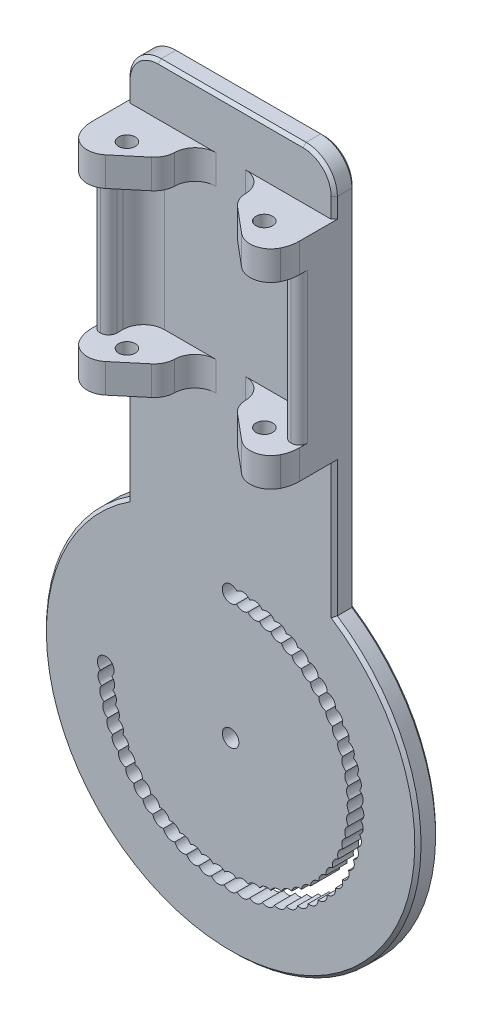
from build123d import *

# Parameters (mm, degrees)
BOSS_EXTRUDE2_DEPTH     = 7
CUT_EXTRUDE2_DEPTH      = 30.130224853
CUT_EXTRUDE2_DEPTH_BACK = 30.130224853
SKETCH3_R               = 2
BOSS_EXTRUDE3_DEPTH     = 36
SKETCH5_R               = 2
BOSS_EXTRUDE4_DEPTH     = 7
SKETCH13_W              = 49.8
SKETCH13_H              = 5
BOSS_EXTRUDE6_DEPTH     = 12.25
SKETCH14_R              = 2
BOSS_EXTRUDE7_DEPTH     = 5
FILLET1_DEPTH           = 7
FILLET1_START           = 43
FILLET1_2_DEPTH         = 7
FILLET3_R               = 2
FILLET4_R               = 5
FILLET5_R               = 5
FILLET6_R               = 7.5
CHAMFER1_SIZE           = 0.75


with BuildPart() as part:
    # Sketch1 → Boss-Extrude2 (new body)
    with BuildSketch(Plane(origin=(0, 0, 0), x_dir=(1, 0, 0), z_dir=(0, 1, 0))):
        with BuildLine():
            Line((-24.9, 0), (-24.9, 13.4))
            Line((-24.9, 13.4), (24.9, 13.4))
            Line((24.9, 13.4), (24.9, 0))
            ThreePointArc((24.9, 0), (23.392904185, -4.800819919), (19.412411454, -7.878950407))
            Line((19.412411454, -7.878950407), (8.235013612, 1.5))
            ThreePointArc((8.235013612, 1.5), (11.116692467, 6.448255578), (16.5, 8.4))
            Line((16.5, 8.4), (-16.5, 8.4))
            ThreePointArc((-16.5, 8.4), (-11.116692467, 6.448255578), (-8.235013612, 1.5))
            Line((-8.235013612, 1.5), (-19.412411454, -7.878950407))
            ThreePointArc((-19.412411454, -7.878950407), (-23.392904185, -4.800819919), (-24.9, 0))
        make_face()
    extrude(amount=BOSS_EXTRUDE2_DEPTH)

    # Sketch3 → Cut-Extrude2 (cut, two sides: drawn at the far end of the back side and taken through both)
    with BuildSketch(Plane(origin=(0, 7, 0), x_dir=(1, 0, 0), z_dir=(0, 1, 0)).offset(-CUT_EXTRUDE2_DEPTH_BACK)):
        with Locations(Location((-16.5, 0, 0), (0, 0, 270))):
            Circle(SKETCH3_R)
        with Locations(Location((16.5, 0, 0), (0, 0, 270))):
            Circle(SKETCH3_R)
    extrude(amount=CUT_EXTRUDE2_DEPTH + CUT_EXTRUDE2_DEPTH_BACK, mode=Mode.SUBTRACT)

    # Sketch4 → Boss-Extrude3 (add)
    with BuildSketch(Plane(origin=(0, 7, 0), x_dir=(1, 0, 0), z_dir=(0, 1, 0))):
        Polygon((-24.9, 13.4), (-24.9, 0), (-20.9, 0), (-20.9, 8.4), (-16.5, 8.4), (16.5, 8.4), (20.9, 8.4), (20.9, 0), (24.9, 0), (24.9, 13.4), align=None)
    extrude(amount=BOSS_EXTRUDE3_DEPTH)

    # Sketch5 → Boss-Extrude4 (add)
    with BuildSketch(Plane(origin=(0, 43, 0), x_dir=(1, 0, 0), z_dir=(0, 1, 0))):
        with BuildLine():
            Line((-24.9, 13.4), (-24.9, 0))
            ThreePointArc((-24.9, 0), (-23.392904185, -4.800819919), (-19.412411454, -7.878950407))
            Line((-19.412411454, -7.878950407), (-8.235013612, 1.5))
            ThreePointArc((-8.235013612, 1.5), (-11.116692467, 6.448255578), (-16.5, 8.4))
            Line((-16.5, 8.4), (16.5, 8.4))
            ThreePointArc((16.5, 8.4), (11.116692467, 6.448255578), (8.235013612, 1.5))
            Line((8.235013612, 1.5), (19.412411454, -7.878950407))
            ThreePointArc((19.412411454, -7.878950407), (23.392904185, -4.800819919), (24.9, 0))
            Line((24.9, 0), (24.9, 13.4))
            Line((24.9, 13.4), (-24.9, 13.4))
        make_face()
        with Locations(Location((16.5, 0, 0), (0, 0, 270))):
            Circle(SKETCH5_R, mode=Mode.SUBTRACT)
        with Locations(Location((-16.5, 0, 0), (0, 0, 270))):
            Circle(SKETCH5_R, mode=Mode.SUBTRACT)
    extrude(amount=BOSS_EXTRUDE4_DEPTH)

    # Sketch13 → Boss-Extrude6 (add)
    with BuildSketch(Plane(origin=(0, 50, 0), x_dir=(1, 0, 0), z_dir=(0, 1, 0))):
        with Locations((0, 10.9)):
            Rectangle(SKETCH13_W, SKETCH13_H)
    extrude(amount=BOSS_EXTRUDE6_DEPTH)

    # Sketch14 → Boss-Extrude7 (add)
    with BuildSketch(Plane(origin=(0, 0, -13.4), x_dir=(-1, 0, 0), z_dir=(0, 0, -1))):
        with BuildLine():
            Line((-24.9, 0), (24.9, 0))
            Line((24.9, 0), (24.9, -32.516803765))
            ThreePointArc((24.9, -32.516803765), (0, -115), (-24.9, -32.516803765))
            Line((-24.9, -32.516803765), (-24.9, 0))
        make_face()
        with Locations((0, -70)):
            Circle(SKETCH14_R, mode=Mode.SUBTRACT)
        with BuildLine():
            ThreePointArc((-1.403822899, -41.424528438), (1.997590912, -39.901864651), (-1.536691311, -38.719929762))
            ThreePointArc((-1.536691311, -38.719929762), (-3.136548491, -38.154088746), (-4.595274757, -39.021173938))
            ThreePointArc((-4.595274757, -39.021173938), (-6.242890305, -38.614871027), (-7.609603194, -39.620761144))
            ThreePointArc((-7.609603194, -39.620761144), (-9.289109672, -39.377909257), (-10.550646993, -40.512917026))
            ThreePointArc((-10.550646993, -40.512917026), (-12.245869836, -40.43585496), (-13.390082294, -41.689049637))
            ThreePointArc((-13.390082294, -41.689049637), (-15.084695578, -41.778519541), (-16.100563782, -43.137832177))
            ThreePointArc((-16.100563782, -43.137832177), (-17.778247457, -43.392972406), (-18.65598804, -44.845312077))
            ThreePointArc((-18.65598804, -44.845312077), (-20.300585093, -45.263665492), (-21.031744934, -46.795045372))
            ThreePointArc((-21.031744934, -46.795045372), (-22.627416998, -47.372583002), (-23.204954628, -48.968255066))
            ThreePointArc((-23.204954628, -48.968255066), (-24.736334508, -49.699414907), (-25.154687923, -51.34401196))
            ThreePointArc((-25.154687923, -51.34401196), (-26.607027594, -52.221752543), (-26.862167823, -53.899436218))
            ThreePointArc((-26.862167823, -53.899436218), (-28.221480459, -54.915304422), (-28.310950363, -56.609917706))
            ThreePointArc((-28.310950363, -56.609917706), (-29.56414504, -57.754130164), (-29.487082974, -59.449353007))
            ThreePointArc((-29.487082974, -59.449353007), (-30.622090743, -60.710890328), (-30.379238856, -62.390396806))
            ThreePointArc((-30.379238856, -62.390396806), (-31.385128973, -63.757109695), (-30.978826062, -65.404725243))
            ThreePointArc((-30.978826062, -65.404725243), (-31.845911254, -66.863451509), (-31.280070238, -68.463308689))
            ThreePointArc((-31.280070238, -68.463308689), (-32, -70), (-31.280070238, -71.536691311))
            ThreePointArc((-31.280070238, -71.536691311), (-31.845911254, -73.136548491), (-30.978826062, -74.595274757))
            ThreePointArc((-30.978826062, -74.595274757), (-31.385128973, -76.242890305), (-30.379238856, -77.609603194))
            ThreePointArc((-30.379238856, -77.609603194), (-30.622090743, -79.289109672), (-29.487082974, -80.550646993))
            ThreePointArc((-29.487082974, -80.550646993), (-29.56414504, -82.245869836), (-28.310950363, -83.390082294))
            ThreePointArc((-28.310950363, -83.390082294), (-28.221480459, -85.084695578), (-26.862167823, -86.100563782))
            ThreePointArc((-26.862167823, -86.100563782), (-26.607027594, -87.778247457), (-25.154687923, -88.65598804))
            ThreePointArc((-25.154687923, -88.65598804), (-24.736334508, -90.300585093), (-23.204954628, -91.031744934))
            ThreePointArc((-23.204954628, -91.031744934), (-22.627416998, -92.627416998), (-21.031744934, -93.204954628))
            ThreePointArc((-21.031744934, -93.204954628), (-20.300585093, -94.736334508), (-18.65598804, -95.154687923))
            ThreePointArc((-18.65598804, -95.154687923), (-17.778247457, -96.607027594), (-16.100563782, -96.862167823))
            ThreePointArc((-16.100563782, -96.862167823), (-15.084695578, -98.221480459), (-13.390082294, -98.310950363))
            ThreePointArc((-13.390082294, -98.310950363), (-12.245869836, -99.56414504), (-10.550646993, -99.487082974))
            ThreePointArc((-10.550646993, -99.487082974), (-9.289109672, -100.622090743), (-7.609603194, -100.379238856))
            ThreePointArc((-7.609603194, -100.379238856), (-6.242890305, -101.385128973), (-4.595274757, -100.978826062))
            ThreePointArc((-4.595274757, -100.978826062), (-3.136548491, -101.845911254), (-1.536691311, -101.280070238))
            ThreePointArc((-1.536691311, -101.280070238), (0, -102), (1.536691311, -101.280070238))
            ThreePointArc((1.536691311, -101.280070238), (3.136548491, -101.845911254), (4.595274757, -100.978826062))
            ThreePointArc((4.595274757, -100.978826062), (6.242890305, -101.385128973), (7.609603194, -100.379238856))
            ThreePointArc((7.609603194, -100.379238856), (9.289109672, -100.622090743), (10.550646993, -99.487082974))
            ThreePointArc((10.550646993, -99.487082974), (12.245869836, -99.56414504), (13.390082294, -98.310950363))
            ThreePointArc((13.390082294, -98.310950363), (15.084695578, -98.221480459), (16.100563782, -96.862167823))
            ThreePointArc((16.100563782, -96.862167823), (17.778247457, -96.607027594), (18.65598804, -95.154687923))
            ThreePointArc((18.65598804, -95.154687923), (20.300585093, -94.736334508), (21.031744934, -93.204954628))
            ThreePointArc((21.031744934, -93.204954628), (22.627416998, -92.627416998), (23.204954628, -91.031744934))
            ThreePointArc((23.204954628, -91.031744934), (24.736334508, -90.300585093), (25.154687923, -88.65598804))
            ThreePointArc((25.154687923, -88.65598804), (26.607027594, -87.778247457), (26.862167823, -86.100563782))
            ThreePointArc((26.862167823, -86.100563782), (28.221480459, -85.084695578), (28.310950363, -83.390082294))
            ThreePointArc((28.310950363, -83.390082294), (29.56414504, -82.245869836), (29.487082974, -80.550646993))
            ThreePointArc((29.487082974, -80.550646993), (30.622090743, -79.289109672), (30.379238856, -77.609603194))
            ThreePointArc((30.379238856, -77.609603194), (31.385128973, -76.242890305), (30.978826062, -74.595274757))
            ThreePointArc((30.978826062, -74.595274757), (31.845911254, -73.136548491), (31.280070238, -71.536691311))
            ThreePointArc((31.280070238, -71.536691311), (30.098135349, -68.002409088), (28.575471562, -71.403822899))
            ThreePointArc((28.575471562, -71.403822899), (27.865172347, -72.744479929), (28.30027415, -74.197949114))
            ThreePointArc((28.30027415, -74.197949114), (27.461987851, -75.462529016), (27.752529628, -76.951646784))
            ThreePointArc((27.752529628, -76.951646784), (26.794329401, -78.127970963), (26.937513074, -79.638396296))
            ThreePointArc((26.937513074, -79.638396296), (25.86862691, -80.715136106), (25.863073543, -82.232322782))
            ThreePointArc((25.863073543, -82.232322782), (24.693795402, -83.199108631), (24.539558476, -84.708445313))
            ThreePointArc((24.539558476, -84.708445313), (23.281149144, -85.555966525), (22.979714046, -87.042917476))
            ThreePointArc((22.979714046, -87.042917476), (21.644292694, -87.763011957), (21.198562409, -89.213257026))
            ThreePointArc((21.198562409, -89.213257026), (19.798989873, -89.798989873), (19.213257026, -91.198562409))
            ThreePointArc((19.213257026, -91.198562409), (17.763011957, -91.644292694), (17.042917476, -92.979714046))
            ThreePointArc((17.042917476, -92.979714046), (15.555966525, -93.281149144), (14.708445313, -94.539558476))
            ThreePointArc((14.708445313, -94.539558476), (13.199108631, -94.693795402), (12.232322782, -95.863073543))
            ThreePointArc((12.232322782, -95.863073543), (10.715136106, -95.86862691), (9.638396296, -96.937513074))
            ThreePointArc((9.638396296, -96.937513074), (8.127970963, -96.794329401), (6.951646784, -97.752529628))
            ThreePointArc((6.951646784, -97.752529628), (5.462529016, -97.461987851), (4.197949114, -98.30027415))
            ThreePointArc((4.197949114, -98.30027415), (2.744479929, -97.865172347), (1.403822899, -98.575471562))
            ThreePointArc((1.403822899, -98.575471562), (0, -98), (-1.403822899, -98.575471562))
            ThreePointArc((-1.403822899, -98.575471562), (-2.744479929, -97.865172347), (-4.197949114, -98.30027415))
            ThreePointArc((-4.197949114, -98.30027415), (-5.462529016, -97.461987851), (-6.951646784, -97.752529628))
            ThreePointArc((-6.951646784, -97.752529628), (-8.127970963, -96.794329401), (-9.638396296, -96.937513074))
            ThreePointArc((-9.638396296, -96.937513074), (-10.715136106, -95.86862691), (-12.232322782, -95.863073543))
            ThreePointArc((-12.232322782, -95.863073543), (-13.199108631, -94.693795402), (-14.708445313, -94.539558476))
            ThreePointArc((-14.708445313, -94.539558476), (-15.555966525, -93.281149144), (-17.042917476, -92.979714046))
            ThreePointArc((-17.042917476, -92.979714046), (-17.763011957, -91.644292694), (-19.213257026, -91.198562409))
            ThreePointArc((-19.213257026, -91.198562409), (-19.798989873, -89.798989873), (-21.198562409, -89.213257026))
            ThreePointArc((-21.198562409, -89.213257026), (-21.644292694, -87.763011957), (-22.979714046, -87.042917476))
            ThreePointArc((-22.979714046, -87.042917476), (-23.281149144, -85.555966525), (-24.539558476, -84.708445313))
            ThreePointArc((-24.539558476, -84.708445313), (-24.693795402, -83.199108631), (-25.863073543, -82.232322782))
            ThreePointArc((-25.863073543, -82.232322782), (-25.86862691, -80.715136106), (-26.937513074, -79.638396296))
            ThreePointArc((-26.937513074, -79.638396296), (-26.794329401, -78.127970963), (-27.752529628, -76.951646784))
            ThreePointArc((-27.752529628, -76.951646784), (-27.461987851, -75.462529016), (-28.30027415, -74.197949114))
            ThreePointArc((-28.30027415, -74.197949114), (-27.865172347, -72.744479929), (-28.575471562, -71.403822899))
            ThreePointArc((-28.575471562, -71.403822899), (-28, -70), (-28.575471562, -68.596177101))
            ThreePointArc((-28.575471562, -68.596177101), (-27.865172347, -67.255520071), (-28.30027415, -65.802050886))
            ThreePointArc((-28.30027415, -65.802050886), (-27.461987851, -64.537470984), (-27.752529628, -63.048353216))
            ThreePointArc((-27.752529628, -63.048353216), (-26.794329401, -61.872029037), (-26.937513074, -60.361603704))
            ThreePointArc((-26.937513074, -60.361603704), (-25.86862691, -59.284863894), (-25.863073543, -57.767677218))
            ThreePointArc((-25.863073543, -57.767677218), (-24.693795402, -56.800891369), (-24.539558476, -55.291554687))
            ThreePointArc((-24.539558476, -55.291554687), (-23.281149144, -54.444033475), (-22.979714046, -52.957082524))
            ThreePointArc((-22.979714046, -52.957082524), (-21.644292694, -52.236988043), (-21.198562409, -50.786742974))
            ThreePointArc((-21.198562409, -50.786742974), (-19.798989873, -50.201010127), (-19.213257026, -48.801437591))
            ThreePointArc((-19.213257026, -48.801437591), (-17.763011957, -48.355707306), (-17.042917476, -47.020285954))
            ThreePointArc((-17.042917476, -47.020285954), (-15.555966525, -46.718850856), (-14.708445313, -45.460441524))
            ThreePointArc((-14.708445313, -45.460441524), (-13.199108631, -45.306204598), (-12.232322782, -44.136926457))
            ThreePointArc((-12.232322782, -44.136926457), (-10.715136106, -44.13137309), (-9.638396296, -43.062486926))
            ThreePointArc((-9.638396296, -43.062486926), (-8.127970963, -43.205670599), (-6.951646784, -42.247470372))
            ThreePointArc((-6.951646784, -42.247470372), (-5.462529016, -42.538012149), (-4.197949114, -41.69972585))
            ThreePointArc((-4.197949114, -41.69972585), (-2.744479929, -42.134827653), (-1.403822899, -41.424528438))
        make_face(mode=Mode.SUBTRACT)
    extrude(amount=-BOSS_EXTRUDE7_DEPTH)

    # Fillet1: read off the stored shape, not the designer's step
    # Fillet1 outline → Fillet1 (add)
    with BuildSketch(Plane(origin=(0, 0, 0), x_dir=(1, 0, 0), z_dir=(0, 1, 0))):
        with BuildLine():
            Line((16.5, 8.4), (3.538518603, 8.4))
            ThreePointArc((3.538518603, 8.4), (7.497261054, 6.454236109), (8.374892259, 2.131343284))
            ThreePointArc((8.374892259, 2.131343284), (11.368883337, 6.650687317), (16.5, 8.4))
        make_face()
        with BuildLine():
            ThreePointArc((-8.374892259, 2.131343284), (-7.497261054, 6.454236109), (-3.538518603, 8.4))
            Line((-3.538518603, 8.4), (-16.5, 8.4))
            ThreePointArc((-16.5, 8.4), (-11.368883337, 6.650687317), (-8.374892259, 2.131343284))
        make_face()
    extrude(amount=FILLET1_DEPTH)

    # Fillet1 2 outline → Fillet1 2 (add)
    with BuildSketch(Plane(origin=(0, 0, 0), x_dir=(1, 0, 0), z_dir=(0, 1, 0)).offset(FILLET1_START)):
        with BuildLine():
            Line((16.5, 8.4), (3.538518603, 8.4))
            ThreePointArc((3.538518603, 8.4), (7.497261054, 6.454236109), (8.374892259, 2.131343284))
            ThreePointArc((8.374892259, 2.131343284), (11.368883337, 6.650687317), (16.5, 8.4))
        make_face()
        with BuildLine():
            ThreePointArc((-8.374892259, 2.131343284), (-7.497261054, 6.454236109), (-3.538518603, 8.4))
            Line((-3.538518603, 8.4), (-16.5, 8.4))
            ThreePointArc((-16.5, 8.4), (-11.368883337, 6.650687317), (-8.374892259, 2.131343284))
        make_face()
    extrude(amount=FILLET1_2_DEPTH)

    # Fillet3
    fillet3_edges = [part.edges().sort_by_distance(p)[0] for p in [
        (-24.9, 25, 0),
        (-20.9, 25, 0),
        (20.9, 25, 0),
        (24.9, 25, 0),
    ]]
    fillet(fillet3_edges, radius=FILLET3_R - 0.0001)  # a hair under: the kernel refuses the full size

    # Fillet4
    fillet4_edges = [part.edges().sort_by_distance(p)[0] for p in [
        (19.412411454, 3.5, 7.878950407),
        (-19.412411454, 3.5, 7.878950407),
        (-20.9, 25, -8.4),
        (20.9, 25, -8.4),
        (-19.412411454, 46.5, 7.878950407),
        (19.412411454, 46.5, 7.878950407),
    ]]
    fillet(fillet4_edges, radius=FILLET4_R)

    # Fillet5
    fillet5_edges = [part.edges().sort_by_distance(p)[0] for p in [
        (8.235013612, 46.5, -1.5),
        (8.235013612, 3.5, -1.5),
        (-8.235013612, 3.5, -1.5),
        (-8.235013612, 46.5, -1.5),
    ]]
    fillet(fillet5_edges, radius=FILLET5_R)

    # Fillet6
    fillet6_edges = [part.edges().sort_by_distance(p)[0] for p in [
        (-24.9, 62.25, -10.9),
        (24.9, 62.25, -10.9),
    ]]
    fillet(fillet6_edges, radius=FILLET6_R)

    # Chamfer1
    chamfer1_edges = [part.edges().sort_by_distance(p)[0] for p in [
        (24.9, -16.258401882, -8.4),
        (-24.9, -16.258401882, -8.4),
        (0, -115, -8.4),
        (0, -115, -13.4),
        (0, 62.25, -8.4),
        (0, 62.25, -13.4),
        (24.9, 11.116598118, -13.4),
        (-24.9, 11.116598118, -13.4),
        (-22.703300859, 60.053300859, -13.4),
        (22.703300859, 60.053300859, -13.4),
        (24.9, 52.375, -8.4),
        (-24.9, 52.375, -8.4),
        (-22.703300859, 60.053300859, -8.4),
        (22.703300859, 60.053300859, -8.4),
    ]]
    chamfer(chamfer1_edges, length=CHAMFER1_SIZE)


solid = part.part
